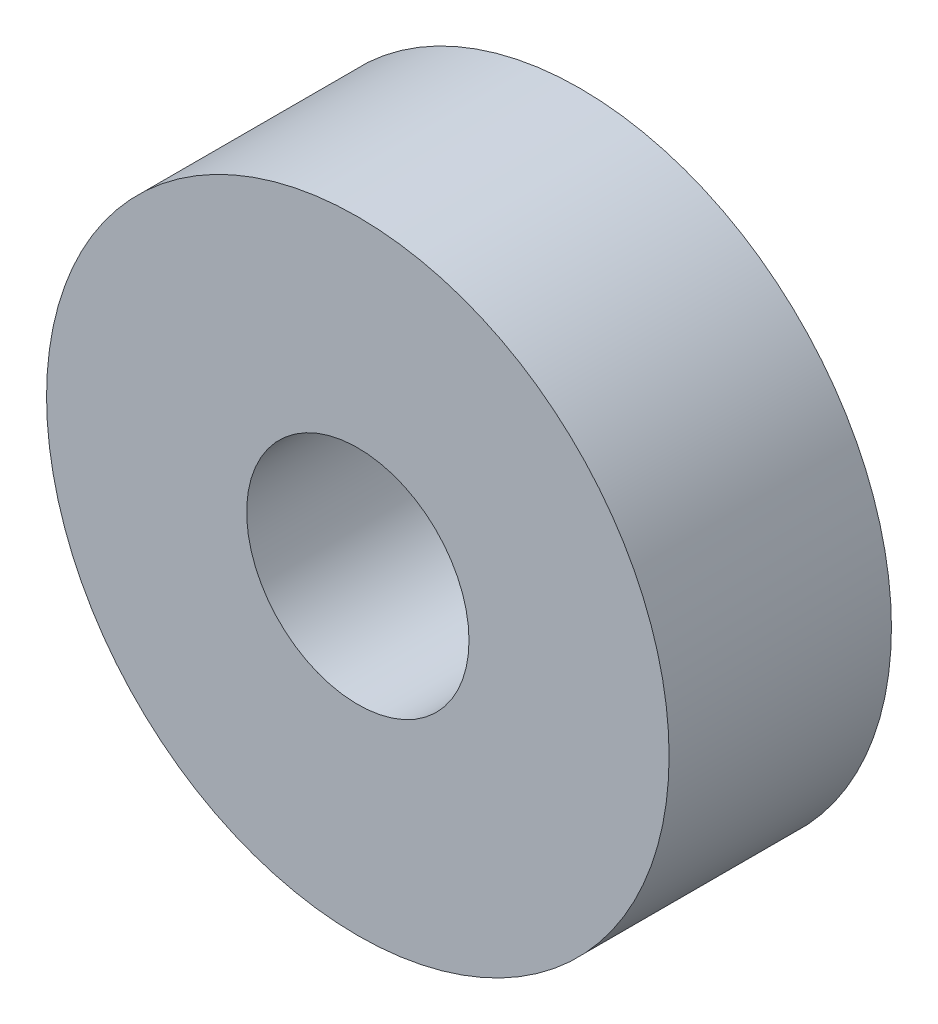
from build123d import *

# Parameters (mm, degrees)
SKETCH1_R                = 7
BOSS_EXTRUDE1_DEPTH      = 5
F_5_0_5_DIAMETER_HOLE1_D = 5


with BuildPart() as part:
    # Sketch1 → Boss-Extrude1 (new body)
    with BuildSketch(Plane.XY.offset(5)):
        Circle(SKETCH1_R)
    extrude(amount=-BOSS_EXTRUDE1_DEPTH)

    # Ø5.0 (5) Diameter Hole1 (through all)
    with Locations(Plane.XY.offset(5)):
        with Locations((0, 0)):
            Hole(F_5_0_5_DIAMETER_HOLE1_D / 2)


solid = part.part
